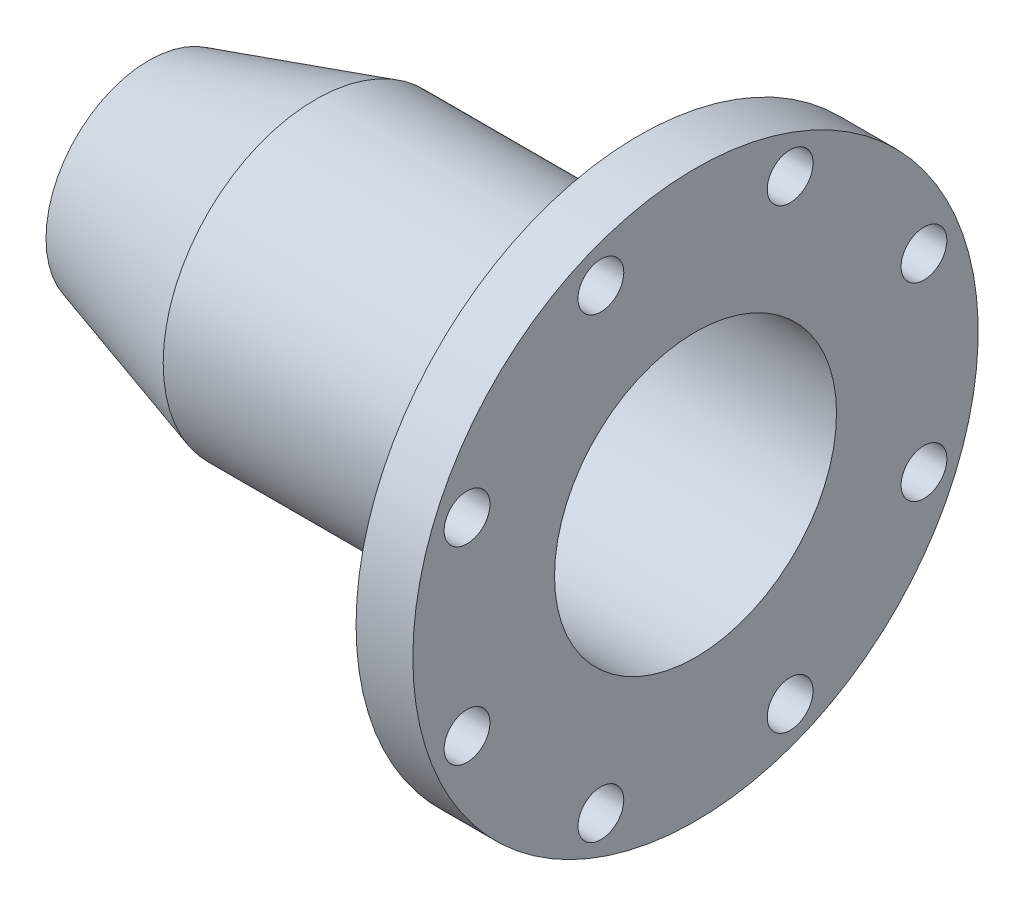
from build123d import *

# Parameters (mm, degrees)
F_1_16_0_88_DIAMETER_HOLE1_D = 22.352
CIRPATTERN1_COUNT            = 8


with BuildPart() as part:
    # Sketch1 → Revolve1 (revolve)
    with BuildSketch(Plane.XY):
        Polygon((266.7, 68.795), (266.7, 137.92), (239.01, 137.92), (239.01, 74.295), (81.28, 74.295), (0, 50.18683312), (0, 44.45), (82.078476138, 68.795), align=None)
    revolve(axis=Axis((0, 0, 0), (1, 0, 0)))

    # 1/16 (0.88) Diameter Hole1 (through all)
    with Locations(Plane(origin=(266.7, 111.466065597, 46.170756115), x_dir=(0, 0, 1), z_dir=(1, 0, 0))):
        with Locations((0, 0)):
            f_1_16_0_88_diameter_hole1 = Hole(F_1_16_0_88_DIAMETER_HOLE1_D / 2)

    # CirPattern1: 1/16 (0.88) Diameter Hole1 ×8 about axis
    cirpattern1_axis = Axis((0, 0, 0), (-1, 0, 0))
    for i in range(1, CIRPATTERN1_COUNT):
        add(f_1_16_0_88_diameter_hole1.rotate(cirpattern1_axis, i * 360 / CIRPATTERN1_COUNT), mode=Mode.SUBTRACT)


solid = part.part
